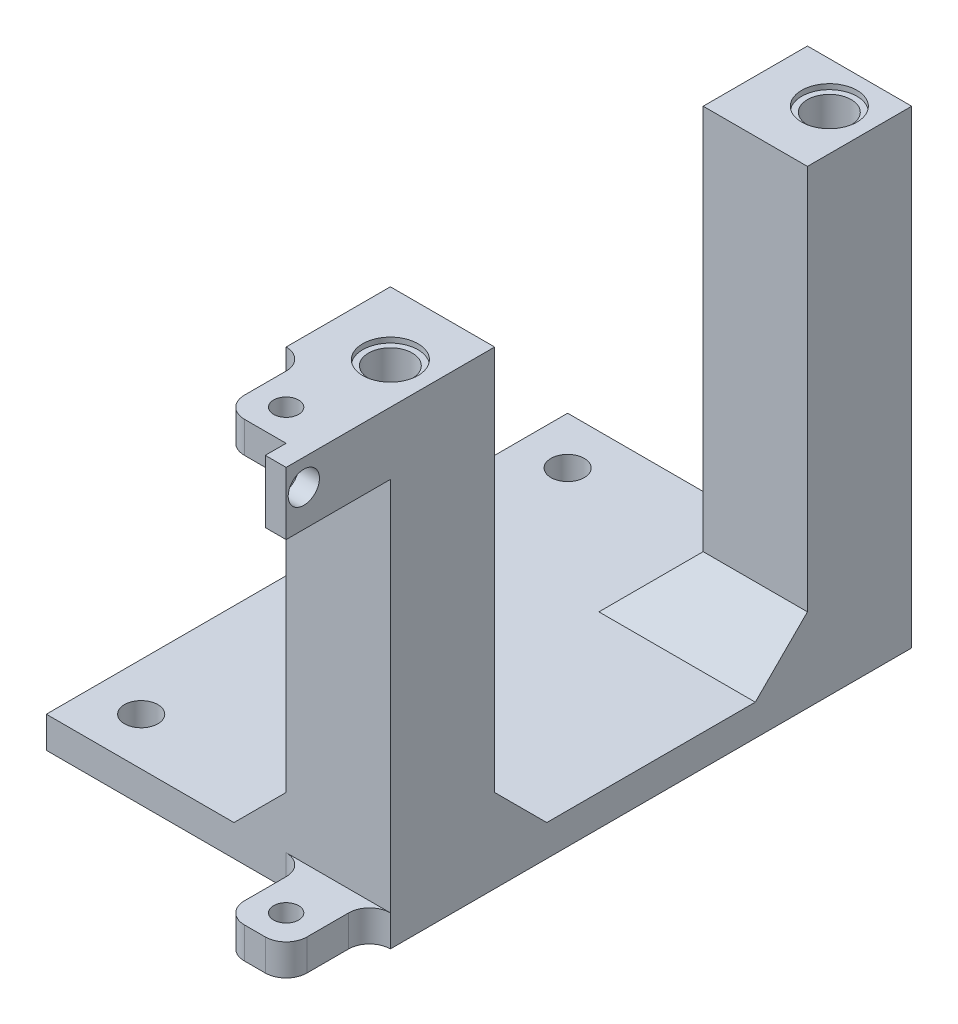
from build123d import *

# Parameters (mm, degrees)
SKETCH1_R           = 1.6
BOSS_EXTRUDE1_DEPTH = 3
SKETCH2_W           = 10
SKETCH2_H           = 10
BOSS_EXTRUDE2_DEPTH = 42
CHAMFER1_SIZE       = 5
SKETCH3_R           = 2.1
CUT_EXTRUDE1_DEPTH  = 52
SKETCH4_R           = 2.65
CUT_EXTRUDE2_DEPTH  = 0.5
SKETCH11_W          = 6
SKETCH11_H          = 3
BOSS_EXTRUDE7_DEPTH = 8
SKETCH12_R          = 1.2
CUT_EXTRUDE5_DEPTH  = 72.139584736
FILLET1_R           = 2
SKETCH13_W          = 2
SKETCH13_H          = 3
BOSS_EXTRUDE8_DEPTH = 10
SKETCH14_W          = 2
SKETCH14_H          = 10
BOSS_EXTRUDE9_DEPTH = 3
SKETCH15_R          = 1.5
CUT_EXTRUDE6_DEPTH  = 3


with BuildPart() as part:
    # Sketch1 → Boss-Extrude1 (new body)
    with BuildSketch(Plane(origin=(0, 0, 0), x_dir=(1, 0, 0), z_dir=(0, 1, 0))):
        Polygon((-6.512396694, 9.685950413), (1.487603306, 9.685950413), (26.487603306, 9.685950413), (26.487603306, -40.314049587), (1.487603306, -40.314049587), (-6.512396694, -40.314049587), align=None)
        with Locations(Location((-1.962396694, -35.764049587, 0), (0, 0, 270))):
            Circle(SKETCH1_R, mode=Mode.SUBTRACT)
        with Locations(Location((-1.962396694, 5.135950413, 0), (0, 0, 270))):
            Circle(SKETCH1_R, mode=Mode.SUBTRACT)
    extrude(amount=BOSS_EXTRUDE1_DEPTH)

    # Sketch2 → Boss-Extrude2 (add)
    with BuildSketch(Plane(origin=(0, 3, 0), x_dir=(1, 0, 0), z_dir=(0, 1, 0))):
        with Locations((21.487603306, -35.314049587)):
            Rectangle(SKETCH2_W, SKETCH2_H)
        with Locations((21.487603306, 4.685950413)):
            Rectangle(SKETCH2_W, SKETCH2_H)
    extrude(amount=BOSS_EXTRUDE2_DEPTH)

    # Chamfer1
    chamfer1_edges = [part.edges().sort_by_distance(p)[0] for p in [
        (21.487603306, 3, 30.314049587),
        (16.487603306, 3, 35.314049587),
        (16.487603306, 3, -4.685950413),
        (21.487603306, 3, 0.314049587),
    ]]
    chamfer(chamfer1_edges, length=CHAMFER1_SIZE)

    # Sketch3 → Cut-Extrude1 (cut)
    with BuildSketch(Plane(origin=(0, 45, 0), x_dir=(1, 0, 0), z_dir=(0, 1, 0))):
        with Locations(Location((22.537603306, -36.364049587, 0), (0, 0, 270))):
            Circle(SKETCH3_R)
        with Locations(Location((22.537603306, 5.735950413, 0), (0, 0, 270))):
            Circle(SKETCH3_R)
    extrude(amount=-CUT_EXTRUDE1_DEPTH, mode=Mode.SUBTRACT)

    # Sketch4 → Cut-Extrude2 (cut)
    with BuildSketch(Plane(origin=(0, 45, 0), x_dir=(1, 0, 0), z_dir=(0, 1, 0))):
        with Locations(Location((22.537603306, -36.364049587, 0), (0, 0, 270))):
            Circle(SKETCH4_R)
        with Locations(Location((22.537603306, 5.735950413, 0), (0, 0, 270))):
            Circle(SKETCH4_R)
    cut_extrude2 = extrude(amount=-CUT_EXTRUDE2_DEPTH, mode=Mode.SUBTRACT)

    # Mirror1: Cut-Extrude2 across plane
    add(cut_extrude2.mirror(Plane(origin=(0, 22.5, 0), x_dir=(0, 0, 1), z_dir=(0, -1, 0))), mode=Mode.SUBTRACT)

    # Sketch11 → Boss-Extrude7 (add)
    with BuildSketch(Plane.XY.offset(40.314049587)):
        with Locations((21.487603306, 43.5)):
            Rectangle(SKETCH11_W, SKETCH11_H)
        with Locations((21.487603306, 1.5)):
            Rectangle(SKETCH11_W, SKETCH11_H)
    extrude(amount=BOSS_EXTRUDE7_DEPTH)

    # Sketch12 → Cut-Extrude5 (cut, through all)
    with BuildSketch(Plane.XZ):
        with Locations(Location((21.487603306, 45.314049587, 0), (0, 0, 270))):
            Circle(SKETCH12_R)
    extrude(amount=-CUT_EXTRUDE5_DEPTH, mode=Mode.SUBTRACT)

    # Fillet1
    fillet1_edges = [part.edges().sort_by_distance(p)[0] for p in [
        (18.487603306, 43.5, 40.314049587),
        (18.487603306, 1.5, 40.314049587),
        (24.487603306, 1.5, 40.314049587),
    ]]
    fillet(fillet1_edges, radius=FILLET1_R - 0.0001)  # a hair under: the kernel refuses the full size
    fillet1_2_edges = [part.edges().sort_by_distance(p)[0] for p in [
        (18.487603306, 43.5, 48.314049587),
        (24.487603306, 1.5, 48.314049587),
        (18.487603306, 1.5, 48.314049587),
    ]]
    fillet(fillet1_2_edges, radius=FILLET1_R)

    # Sketch13 → Boss-Extrude8 (add)
    with BuildSketch(Plane.XY.offset(40.314049587)):
        with Locations((25.487603306, 43.5)):
            Rectangle(SKETCH13_W, SKETCH13_H)
    extrude(amount=BOSS_EXTRUDE8_DEPTH)

    # Sketch14 → Boss-Extrude9 (add)
    with BuildSketch(Plane.XZ.offset(-42)):
        with Locations((25.487603306, 45.314049587)):
            Rectangle(SKETCH14_W, SKETCH14_H)
    extrude(amount=BOSS_EXTRUDE9_DEPTH)

    # Sketch15 → Cut-Extrude6 (cut)
    with BuildSketch(Plane(origin=(26.487603306, 0, 0), x_dir=(0, 0, -1), z_dir=(1, 0, 0))):
        with Locations((-48.614049587, 42.5)):
            Circle(SKETCH15_R)
    extrude(amount=-CUT_EXTRUDE6_DEPTH, mode=Mode.SUBTRACT)


solid = part.part
